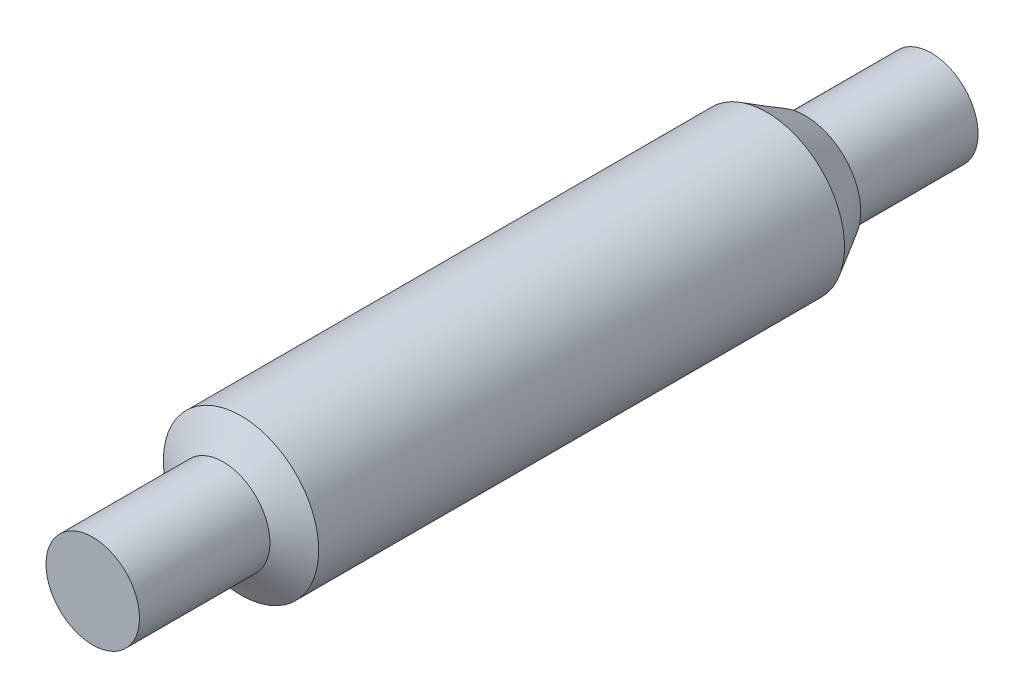
from build123d import *

# Parameters (mm, degrees)
BOSS_EXTRUDE1_DEPTH      = 47.99
BOSS_EXTRUDE1_DEPTH_BACK = 47.99
SKETCH2_R                = 5.35
BOSS_EXTRUDE2_DEPTH      = 33.56
BOSS_EXTRUDE2_DEPTH_BACK = 33.56
SKETCH3_R                = 8.89
CHAMFER1_SIZE            = 4.399409051
CHAMFER1_SIZE_2          = 2.54


with BuildPart() as part:
    # Sketch2 → Boss-Extrude1 (new, two sides: drawn at the far end of the back side and taken through both)
    with BuildSketch(Plane.XY.offset(-BOSS_EXTRUDE1_DEPTH_BACK)):
        with Locations(Location((0, 160.02, 0), (0, 0, 180))):
            Circle(SKETCH2_R)
    extrude(amount=BOSS_EXTRUDE1_DEPTH + BOSS_EXTRUDE1_DEPTH_BACK)

    # Sketch3 → Boss-Extrude2 (add, two sides: drawn at the far end of the back side and taken through both)
    with BuildSketch(Plane.XY.offset(-BOSS_EXTRUDE2_DEPTH_BACK)):
        with Locations(Location((0, 160.02, 0), (0, 0, 180))):
            Circle(SKETCH3_R)
    extrude(amount=BOSS_EXTRUDE2_DEPTH + BOSS_EXTRUDE2_DEPTH_BACK)

    # Chamfer1
    # the kernel refuses this chamfer: 4.399409051, 2.54 mm, written as the material it takes off along each edge
    with BuildSketch(Plane(origin=(0, 160.02, -33.56), x_dir=(-1, 0, 0), z_dir=(0, 1, 0))) as chamfer1_piece_1:
        Polygon((8.89, CHAMFER1_SIZE), (8.89 - CHAMFER1_SIZE_2, 0), (8.89, 0), align=None)
    revolve(axis=Axis((0, 160.02, -33.56), (0, 0, 1)), mode=Mode.SUBTRACT)
    with BuildSketch(Plane(origin=(0, 160.02, 33.56), x_dir=(-1, 0, 0), z_dir=(0, 1, 0))) as chamfer1_piece_2_section:
        Polygon((8.89 - CHAMFER1_SIZE, 0), (8.89, -CHAMFER1_SIZE_2), (8.89, 0), align=None)
    chamfer1_piece_2 = revolve(axis=Axis((0, 160.02, 33.56), (0, 0, 1)), mode=Mode.PRIVATE)
    chamfer1_piece_2 = chamfer1_piece_2 - Plane(origin=(0, 160.02, 32.054862078), x_dir=(-1, 0, 0), z_dir=(0, 0, -1)) * Cylinder(5.35, 36, mode=Mode.PRIVATE)
    add(chamfer1_piece_2, mode=Mode.SUBTRACT)


solid = part.part
